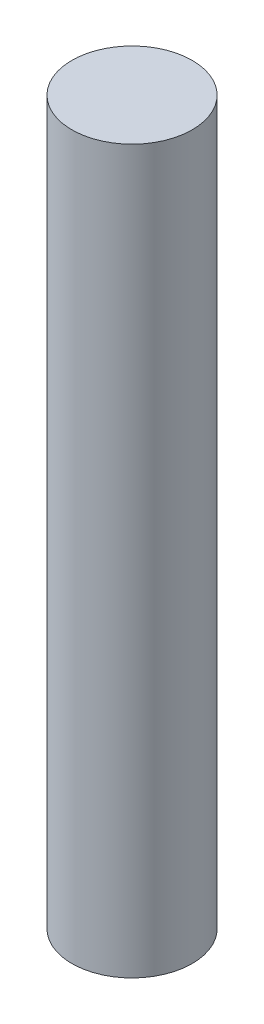
from build123d import *

# Parameters (mm, degrees)
SKETCH1_R           = 3.175
BOSS_EXTRUDE1_DEPTH = 38.1


with BuildPart() as part:
    # Sketch1 → Boss-Extrude1 (new body)
    with BuildSketch(Plane(origin=(0, 0, 0), x_dir=(1, 0, 0), z_dir=(0, 1, 0))):
        Circle(SKETCH1_R)
    extrude(amount=BOSS_EXTRUDE1_DEPTH)


solid = part.part
